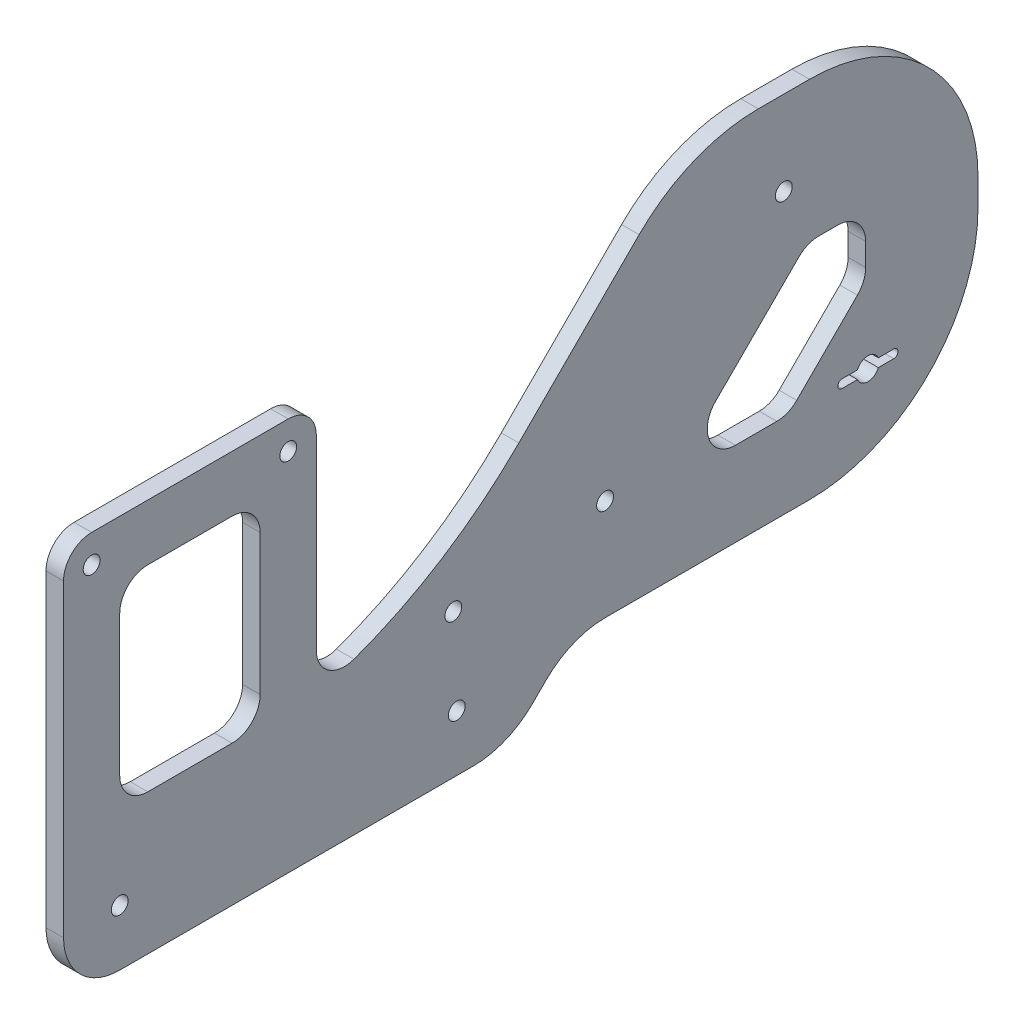
from build123d import *

# Parameters (mm, degrees)
SKETCH1_R           = 1.5
SKETCH1_W           = 25
SKETCH1_H           = 35
BOSS_EXTRUDE1_DEPTH = 3.125
FILLET2_R           = 15
FILLET3_R           = 30
FILLET4_R           = 30
FILLET5_R           = 80
FILLET6_R           = 30
FILLET7_R           = 5
FILLET1_R           = 10
FILLET8_R           = 5


with BuildPart() as part:
    # Sketch1 → Boss-Extrude1 (new body)
    with BuildSketch(Plane(origin=(0, 0, 0), x_dir=(0, 0, -1), z_dir=(1, 0, 0))):
        Polygon((-143.20422433, -1.13137085), (-143.20422433, -26.13137085), (-64.062088707, -26.13137085), (-52.930717857, -15), (19.6, -15), (19.6, 49.830569927), (-31.940768363, 49.830569927), (-82.90270914, -1.13137085), (-98.20422433, -1.13137085), (-98.20422433, 43.86862915), (-143.20422433, 43.86862915), align=None)
        with Locations((-46.799347007, 3.010764774)):
            Circle(SKETCH1_R, mode=Mode.SUBTRACT)
        with Locations((-14.979541854, 34.830569927)):
            Circle(SKETCH1_R, mode=Mode.SUBTRACT)
        with Locations((-73.810826048, -0.524769132)):
            Circle(SKETCH1_R, mode=Mode.SUBTRACT)
        with Locations((-73.20422433, -16.13137085)):
            Circle(SKETCH1_R, mode=Mode.SUBTRACT)
        with Locations((-133.20422433, -16.13137085)):
            Circle(SKETCH1_R, mode=Mode.SUBTRACT)
        with Locations((-138.20422433, 38.86862915)):
            Circle(SKETCH1_R, mode=Mode.SUBTRACT)
        with Locations((-103.20422433, 38.86862915)):
            Circle(SKETCH1_R, mode=Mode.SUBTRACT)
        with BuildLine():
            Line((-4.6, 0.75), (-1.854049622, 0.75))
            ThreePointArc((-1.854049622, 0.75), (0, 2), (1.854049622, 0.75))
            Line((1.854049622, 0.75), (4.6, 0.75))
            ThreePointArc((4.6, 0.75), (5.35, 0), (4.6, -0.75))
            Line((4.6, -0.75), (1.854049622, -0.75))
            ThreePointArc((1.854049622, -0.75), (0, -2), (-1.854049622, -0.75))
            Line((-1.854049622, -0.75), (-4.6, -0.75))
            ThreePointArc((-4.6, -0.75), (-5.35, 0), (-4.6, 0.75))
        make_face(mode=Mode.SUBTRACT)
        Polygon((-35.667976157, 0), (-10.83740623, 24.830569927), (-0.4, 24.830569927), (-0.4, 13.742135624), (-14.142135624, 0), align=None, mode=Mode.SUBTRACT)
        with Locations((-120.70422433, 16.36862915)):
            Rectangle(SKETCH1_W, SKETCH1_H, mode=Mode.SUBTRACT)
    extrude(amount=BOSS_EXTRUDE1_DEPTH)

    # Fillet2
    fillet2_edges = [part.edges().sort_by_distance(p)[0] for p in [
        (1.5625, -15, 52.930717857),
        (1.5625, -26.13137085, 64.062088707),
    ]]
    fillet(fillet2_edges, radius=FILLET2_R)

    # Fillet3
    fillet3_edges = [part.edges().sort_by_distance(p)[0] for p in [
        (1.5625, -15, -19.6),
    ]]
    fillet(fillet3_edges, radius=FILLET3_R)

    # Fillet4
    fillet4_edges = [part.edges().sort_by_distance(p)[0] for p in [
        (1.5625, 49.830569927, 31.940768363),
    ]]
    fillet(fillet4_edges, radius=FILLET4_R)

    # Fillet5
    # the kernel refuses this fillet: 80 mm, written as the material it adds along each edge
    with BuildSketch(Plane(origin=(0, -1.13137085, 82.90270914), x_dir=(0, 0.7071067811865434, -0.7071067811865517), z_dir=(1, 0, 0))) as fillet5_piece_1:
        with BuildLine():
            CenterArc((29.356066225, 80), FILLET5_R, 239.854448647, 30.145551353)
            Line((-10.819805153, 10.819805153), (-11.623322581, 9.436201256))
            ThreePointArc((-11.623322581, 9.436201256), (-6.541273427, 4.278531727), (-1.13137085, -1.13137085))
            Line((-1.13137085, -1.13137085), (0, -1.6))
            Line((0, -1.6), (29.356066225, -1.6))
            Line((29.356066225, -1.6), (29.356066225, 0))
        make_face()
    extrude(amount=3.125)

    # Fillet6
    fillet6_edges = [part.edges().sort_by_distance(p)[0] for p in [
        (1.5625, 49.830569927, -19.6),
    ]]
    fillet(fillet6_edges, radius=FILLET6_R)

    # Fillet7
    fillet7_edges = [part.edges().sort_by_distance(p)[0] for p in [
        (1.5625, 13.742135624, 0.4),
        (1.5625, 24.830569927, 0.4),
        (1.5625, 24.830569927, 10.83740623),
        (1.5625, 0, 35.667976157),
        (1.5625, 0, 14.142135624),
    ]]
    fillet(fillet7_edges, radius=FILLET7_R)

    # Fillet1
    fillet1_edges = [part.edges().sort_by_distance(p)[0] for p in [
        (1.5625, -26.13137085, 143.20422433),
    ]]
    fillet(fillet1_edges, radius=FILLET1_R)

    # Fillet8
    fillet8_edges = [part.edges().sort_by_distance(p)[0] for p in [
        (1.5625, 43.86862915, 143.20422433),
        (1.5625, 43.86862915, 98.20422433),
        (1.5625, -1.13137085, 98.20422433),
        (1.5625, 33.86862915, 133.20422433),
        (1.5625, -1.13137085, 133.20422433),
        (1.5625, -1.13137085, 108.20422433),
        (1.5625, 33.86862915, 108.20422433),
    ]]
    fillet(fillet8_edges, radius=FILLET8_R)


solid = part.part
